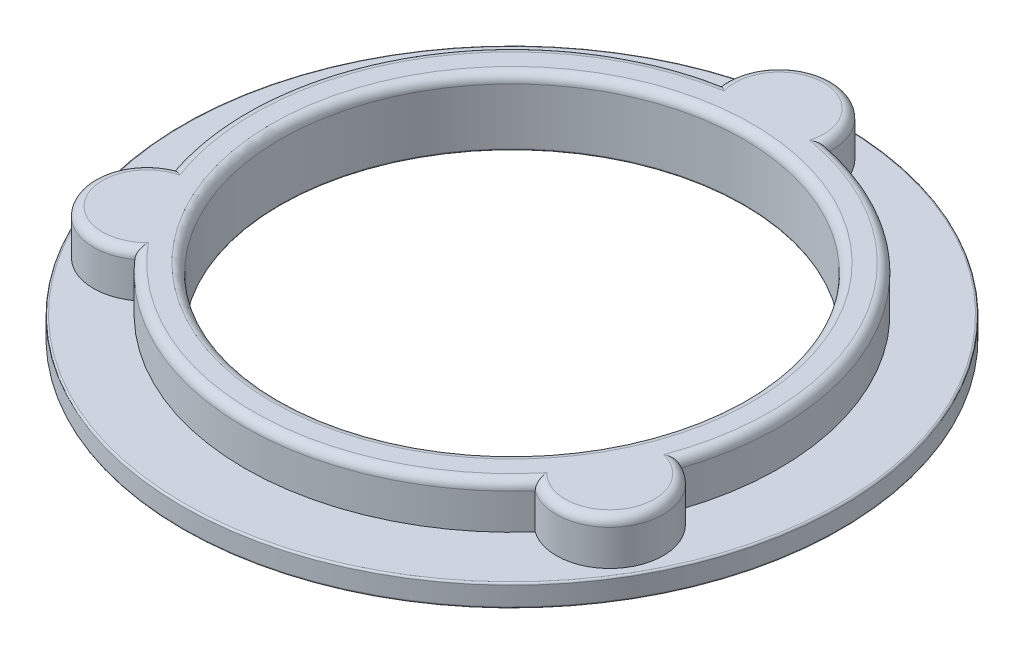
from build123d import *

# Parameters (mm, degrees)
SKETCH1_R           = 18.5
SKETCH1_R_2         = 13
BOSS_EXTRUDE1_DEPTH = 1.25
SKETCH2_R           = 13
BOSS_EXTRUDE2_DEPTH = 2.5
FILLET1_R           = 0.5
FILLET2_R           = 0.1


with BuildPart() as part:
    # Sketch1 → Boss-Extrude1 (new body)
    with BuildSketch(Plane(origin=(0, 0, 0), x_dir=(1, 0, 0), z_dir=(0, 1, 0))):
        Circle(SKETCH1_R)
        Circle(SKETCH1_R_2, mode=Mode.SUBTRACT)
    extrude(amount=BOSS_EXTRUDE1_DEPTH)

    # Sketch2 → Boss-Extrude2 (add)
    with BuildSketch(Plane(origin=(0, 1.25, 0), x_dir=(1, 0, 0), z_dir=(0, 1, 0))):
        with BuildLine():
            ThreePointArc((14.223054591, -4.764946809), (12.990381057, 7.5), (2.984962311, 14.7))
            ThreePointArc((2.984962311, 14.7), (0, 18), (-2.984962311, 14.7))
            ThreePointArc((-2.984962311, 14.7), (-12.990381057, 7.5), (-14.223054591, -4.764946809))
            ThreePointArc((-14.223054591, -4.764946809), (-15.588457268, -9), (-11.23809228, -9.935053191))
            ThreePointArc((-11.23809228, -9.935053191), (0, -15), (11.23809228, -9.935053191))
            ThreePointArc((11.23809228, -9.935053191), (15.588457268, -9), (14.223054591, -4.764946809))
        make_face()
        Circle(SKETCH2_R, mode=Mode.SUBTRACT)
    extrude(amount=BOSS_EXTRUDE2_DEPTH)

    # Fillet1
    fillet1_edges = [part.edges().sort_by_distance(p)[0] for p in [
        (-13, 3.75, 0),
        (12.990381057, 3.75, -7.5),
        (15.588457268, 3.75, 9),
        (0, 3.75, 15),
        (-15.588457268, 3.75, 9),
        (-12.990381057, 3.75, -7.5),
        (0, 3.75, -18),
    ]]
    fillet(fillet1_edges, radius=FILLET1_R)

    # Fillet2
    fillet2_edges = [part.edges().sort_by_distance(p)[0] for p in [
        (-18.5, 0, 0),
        (-18.5, 1.25, 0),
        (-13, 0, 0),
    ]]
    fillet(fillet2_edges, radius=FILLET2_R)


solid = part.part
